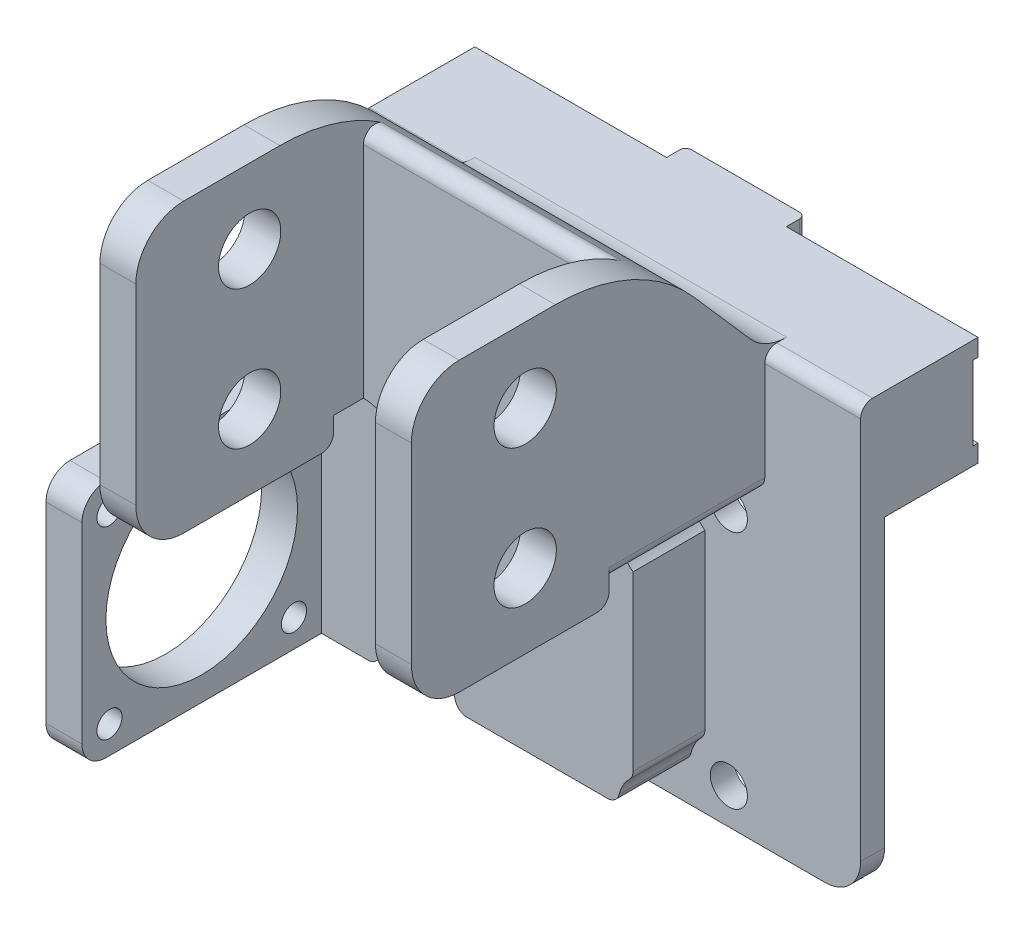
from build123d import *

# Parameters (mm, degrees)
SKETCH1_W           = 36
SKETCH1_H           = 42
SKETCH1_R           = 1.55
BOSS_EXTRUDE1_DEPTH = 2
SKETCH5_W           = 42
SKETCH5_H           = 9.1
BOSS_EXTRUDE2_DEPTH = 7.4
SKETCH6_W           = 10
SKETCH6_H           = 9.1
BOSS_EXTRUDE3_DEPTH = 2
SKETCH2_R           = 3
CUT_EXTRUDE1_DEPTH  = 6
SKETCH4_W           = 16
SKETCH4_H           = 1.45
BOSS_EXTRUDE4_DEPTH = 0.4
FILLET2_R           = 3
FILLET3_R           = 0.5
SKETCH7_W           = 29
SKETCH7_H           = 20
BOSS_EXTRUDE5_DEPTH = 6
SKETCH8_W           = 20
SKETCH8_H           = 20
SKETCH8_R           = 8
SKETCH8_R_2         = 1.05
BOSS_EXTRUDE6_DEPTH = 3
FILLET4_R           = 2
SKETCH10_W          = 24
SKETCH10_H          = 19
SKETCH10_R          = 2.6
BOSS_EXTRUDE7_DEPTH = 3
SKETCH14_W          = 26
SKETCH14_H          = 25
BOSS_EXTRUDE8_DEPTH = 10.5
CUT_EXTRUDE3_REACH  = 60.08
SKETCH9_R           = 3.25
CUT_EXTRUDE2_DEPTH  = 13
FILLET6_R           = 1
FILLET7_R           = 1
FILLET8_R           = 4
FILLET9_R           = 1
FILLET10_R          = 1


with BuildPart() as part:
    # Sketch1 → Boss-Extrude1 (new body)
    with BuildSketch(Plane(origin=(0, 0, 0), x_dir=(0, 1, 0), z_dir=(0, 0, 1))):
        with Locations((5, 0)):
            Rectangle(SKETCH1_W, SKETCH1_H)
        with Locations(Location((-10, -10, 0), (0, 0, 270))):
            Circle(SKETCH1_R, mode=Mode.SUBTRACT)
        with Locations(Location((10, -10, 0), (0, 0, 270))):
            Circle(SKETCH1_R, mode=Mode.SUBTRACT)
        with Locations(Location((10, 10, 0), (0, 0, 270))):
            Circle(SKETCH1_R, mode=Mode.SUBTRACT)
        with Locations(Location((-10, 10, 0), (0, 0, 270))):
            Circle(SKETCH1_R, mode=Mode.SUBTRACT)
    extrude(amount=BOSS_EXTRUDE1_DEPTH)

    # Sketch5 → Boss-Extrude2 (add)
    with BuildSketch(Plane.XY):
        with Locations((0, 18.45)):
            Rectangle(SKETCH5_W, SKETCH5_H)
    extrude(amount=-BOSS_EXTRUDE2_DEPTH)

    # Sketch6 → Boss-Extrude3 (add)
    with BuildSketch(Plane(origin=(0, 0, -7.4), x_dir=(1, 0, 0), z_dir=(0, 0, -1))):
        with Locations((0, -18.45)):
            Rectangle(SKETCH6_W, SKETCH6_H)
    extrude(amount=BOSS_EXTRUDE3_DEPTH)

    # Sketch2 → Cut-Extrude1 (cut)
    with BuildSketch(Plane(origin=(0, 0, -9.4), x_dir=(1, 0, 0), z_dir=(0, 0, -1))):
        with Locations(Location((0, -18.5, 0), (0, 0, 180))):
            Circle(SKETCH2_R)
    extrude(amount=-CUT_EXTRUDE1_DEPTH, mode=Mode.SUBTRACT)

    # Sketch4 → Boss-Extrude4 (add)
    with BuildSketch(Plane(origin=(0, 0, -7.4), x_dir=(1, 0, 0), z_dir=(0, 0, -1))):
        with Locations((-13, -14.625)):
            Rectangle(SKETCH4_W, SKETCH4_H)
        with Locations((-13, -22.275)):
            Rectangle(SKETCH4_W, SKETCH4_H)
        with Locations((13, -14.625)):
            Rectangle(SKETCH4_W, SKETCH4_H)
        with Locations((13, -22.275)):
            Rectangle(SKETCH4_W, SKETCH4_H)
    extrude(amount=BOSS_EXTRUDE4_DEPTH)

    # Fillet2
    fillet2_edges = [part.edges().sort_by_distance(p)[0] for p in [
        (-21, -13, 1),
        (21, -13, 1),
    ]]
    fillet(fillet2_edges, radius=FILLET2_R)

    # Fillet3
    fillet3_edges = [part.edges().sort_by_distance(p)[0] for p in [
        (-5, 18.45, -9.4),
        (5, 18.45, -9.4),
    ]]
    fillet(fillet3_edges, radius=FILLET3_R)

    # Sketch7 → Boss-Extrude5 (add)
    with BuildSketch(Plane.XY.offset(2)):
        with Locations((-6.5, 0)):
            Rectangle(SKETCH7_W, SKETCH7_H)
    extrude(amount=BOSS_EXTRUDE5_DEPTH)

    # Sketch8 → Boss-Extrude6 (add)
    with BuildSketch(Plane(origin=(-21, 0, 0), x_dir=(0, -1, 0), z_dir=(-1, 0, 0))):
        with Locations((0, 18)):
            Rectangle(SKETCH8_W, SKETCH8_H)
        with Locations(Location((0, 18, 0), (0, 0, 90))):
            Circle(SKETCH8_R, mode=Mode.SUBTRACT)
        with Locations(Location((7.7, 25.7, 0), (0, 0, 90))):
            Circle(SKETCH8_R_2, mode=Mode.SUBTRACT)
        with Locations(Location((7.7, 10.3, 0), (0, 0, 90))):
            Circle(SKETCH8_R_2, mode=Mode.SUBTRACT)
        with Locations(Location((-7.7, 25.7, 0), (0, 0, 90))):
            Circle(SKETCH8_R_2, mode=Mode.SUBTRACT)
        with Locations(Location((-7.7, 10.3, 0), (0, 0, 90))):
            Circle(SKETCH8_R_2, mode=Mode.SUBTRACT)
    extrude(amount=-BOSS_EXTRUDE6_DEPTH)

    # Fillet4
    fillet4_edges = [part.edges().sort_by_distance(p)[0] for p in [
        (-19.5, 10, 28),
        (-19.5, -10, 28),
    ]]
    fillet(fillet4_edges, radius=FILLET4_R)



with BuildPart() as body_2:
    # Sketch10 → Boss-Extrude7 (new body)
    with BuildSketch(Plane(origin=(-10, 0, 0), x_dir=(0, 1, 0), z_dir=(-1, 0, 0))):
        with Locations((23, -22)):
            Rectangle(SKETCH10_W, SKETCH10_H)
        with Locations(Location((28.777800617, -22, 0), (0, 0, 270))):
            Circle(SKETCH10_R, mode=Mode.SUBTRACT)
        with Locations(Location((17.222199383, -22, 0), (0, 0, 270))):
            Circle(SKETCH10_R, mode=Mode.SUBTRACT)
    extrude(amount=BOSS_EXTRUDE7_DEPTH)


with BuildPart() as body_3:
    # Mirror1: mirrored copy
    add(body_2.part.mirror(Plane(origin=(0, 0, 0), x_dir=(0, 0, 1), z_dir=(1, 0, 0))))


with BuildPart() as part_1:
    add(part.part)

    add(body_2.part)  # Boss-Extrude8 merges body 2

    add(body_3.part)  # Boss-Extrude8 merges body 3
    # Sketch14 → Boss-Extrude8 (add)
    with BuildSketch(Plane(origin=(0, 0, 12.5), x_dir=(1, 0, 0), z_dir=(0, 0, -1))):
        with Locations((0, -22.5)):
            Rectangle(SKETCH14_W, SKETCH14_H)
    extrude(amount=BOSS_EXTRUDE8_DEPTH)

    # Cut-Extrude3: up to this face of the body (flat: up to its plane)
    cut_extrude3_end = Plane(part_1.part.faces().sort_by_distance((-13, 22.805850567, 16.272591727))[0])
    # Sketch15 → Cut-Extrude3 (cut, up to the picked face)
    with BuildSketch(Plane.YZ.offset(13), mode=Mode.PRIVATE) as cut_extrude3_sk1:
        with BuildLine():
            Line((23, 2), (29.749203665, 7.905553207))
            ThreePointArc((29.749203665, 7.905553207), (33.625901319, 13.123522322), (35, 19.477091335))
            Line((35, 19.477091335), (35, 12.5))
            Line((35, 12.5), (35, 2))
            Line((35, 2), (23, 2))
        make_face()
    cut_extrude3_tool1 = split(extrude(cut_extrude3_sk1.sketch, amount=-CUT_EXTRUDE3_REACH, mode=Mode.PRIVATE), bisect_by=cut_extrude3_end, keep=Keep.BOTH, mode=Mode.PRIVATE)
    # Sketch15 → Cut-Extrude3 (cut, up to the picked face)
    with BuildSketch(Plane.YZ.offset(13), mode=Mode.PRIVATE) as cut_extrude3_sk2:
        Polygon((12.370074724, 12.5), (10, 8), (10, 12.5), align=None)
    cut_extrude3_tool2 = split(extrude(cut_extrude3_sk2.sketch, amount=-CUT_EXTRUDE3_REACH, mode=Mode.PRIVATE), bisect_by=cut_extrude3_end, keep=Keep.BOTH, mode=Mode.PRIVATE)
    add(cut_extrude3_tool1.solids().sort_by(Axis((13, 31.275358, 6.207395), (-1, 0, 0)))[0], mode=Mode.SUBTRACT)
    add(cut_extrude3_tool2.solids().sort_by(Axis((13, 10.790025, 11), (-1, 0, 0)))[0], mode=Mode.SUBTRACT)

    # Sketch9 → Cut-Extrude2 (cut)
    with BuildSketch(Plane.XY.offset(2)):
        with Locations((-10, 10)):
            Circle(SKETCH9_R)
        with Locations((10, 10)):
            Circle(SKETCH9_R)
        with Locations((10, -10)):
            Circle(SKETCH9_R)
        with Locations((-10, -10)):
            Circle(SKETCH9_R)
    extrude(amount=CUT_EXTRUDE2_DEPTH, mode=Mode.SUBTRACT)

    # Fillet6
    # the kernel refuses this fillet: 1 mm, written as the material it takes off along each edge
    with BuildSketch(Plane(origin=(-13, 11.25, 15), x_dir=(0, 1, 0), z_dir=(0, 0, -1))) as fillet6_piece_1:
        with BuildLine():
            CenterArc((2.5, 1), FILLET6_R, 151.927513064, 118.072486936)
            ThreePointArc((1.617647059, 1.470588235), (0.93618658, 0.595194761), (0, 0))
            Line((0, 0), (2.5, 0))
        make_face()
    extrude(amount=8.75, mode=Mode.SUBTRACT)
    with BuildSketch(Plane(origin=(-13, 11.25, 16.623342892), x_dir=(0, 1, 0), z_dir=(0, 0, -1))) as fillet6_piece_2_section:
        with BuildLine():
            CenterArc((2.5, 1), FILLET6_R, 151.927513064, 118.072486936)
            ThreePointArc((1.617647059, 1.470588235), (0.93618658, 0.595194761), (0, 0))
            Line((0, 0), (2.5, 0))
        make_face()
    fillet6_piece_2 = extrude(amount=14.623342892, mode=Mode.PRIVATE)
    fillet6_piece_2 = split(fillet6_piece_2, bisect_by=Plane(origin=(-12.647638468, 12.372868888, 15), z_dir=(0, 0, -1)), keep=Keep.TOP, mode=Mode.PRIVATE)
    add(fillet6_piece_2, mode=Mode.SUBTRACT)
    with BuildSketch(Plane(origin=(-13.25, 10, 10.201694776), x_dir=(-1, 0, 0), z_dir=(0, 0, -1))) as fillet6_piece_3:
        with BuildLine():
            CenterArc((0.88067791, -1), FILLET6_R, 90, 76.391039369)
            ThreePointArc((-0.091246304, -0.764705882), (-0.022892199, -0.385065246), (0, 0))
            Line((0, 0), (0.88067791, 0))
        make_face()
    extrude(amount=8.201694776, mode=Mode.SUBTRACT)
    with BuildSketch(Plane(origin=(-6.75, -10, 2), x_dir=(1, 0, 0), z_dir=(0, 0, 1)), Plane(origin=(-13.25, -10, 10.201694776), x_dir=(-1, 0, 0), z_dir=(0, 0, -1))) as fillet6_piece_4:
        with BuildLine():
            CenterArc((0.88067791, 1), FILLET6_R, 193.608960631, 76.391039369)
            ThreePointArc((-0.091246304, 0.764705882), (-0.022892199, 0.385065246), (0, 0))
            Line((0, 0), (0.88067791, 0))
        make_face()
    extrude(amount=8.201694776, mode=Mode.SUBTRACT)
    with BuildSketch(Plane(origin=(8, -7.438262309, 9.121652383), x_dir=(0, 1, 0), z_dir=(0, 0, -1))) as fillet6_piece_5:
        with BuildLine():
            CenterArc((0.448660953, -1), FILLET6_R, 90, 45.099127844)
            ThreePointArc((-0.25966814, -0.294117647), (-0.125391755, -0.150980818), (0, 0))
            Line((0, 0), (0.448660953, 0))
        make_face()
    extrude(amount=7.121652383, mode=Mode.SUBTRACT)
    with BuildSketch(Plane(origin=(6.75, -10, 10.201694776), x_dir=(0.11848161412860787, 0.9929562463238145, 0), z_dir=(0, 0, -1))) as fillet6_piece_6:
        with BuildLine():
            CenterArc((0.888612106, -0.992956246), FILLET6_R, 96.804480315, 76.391039369)
            Line((-0.10434414, -0.874474632), (0, 0))
            ThreePointArc((0, 0), (0.385065246, -0.022892199), (0.770130492, 0))
        make_face()
    extrude(amount=8.201694776, mode=Mode.SUBTRACT)
    with BuildSketch(Plane(origin=(13, 11.25, 16.623342892), x_dir=(0, 1, 0), z_dir=(0, 0, -1))) as fillet6_piece_7_section:
        with BuildLine():
            CenterArc((2.5, -1), FILLET6_R, 90, 118.072486936)
            ThreePointArc((1.617647059, -1.470588235), (0.93618658, -0.595194761), (0, 0))
            Line((0, 0), (2.5, 0))
        make_face()
    fillet6_piece_7 = extrude(amount=14.623342892, mode=Mode.PRIVATE)
    fillet6_piece_7 = split(fillet6_piece_7, bisect_by=Plane(origin=(12.647638468, 12.372868888, 15), z_dir=(0, 0, -1)), keep=Keep.TOP, mode=Mode.PRIVATE)
    add(fillet6_piece_7, mode=Mode.SUBTRACT)
    with BuildSketch(Plane(origin=(13, 11.25, 15), x_dir=(0, 1, 0), z_dir=(0, 0, -1))) as fillet6_piece_8:
        with BuildLine():
            CenterArc((2.5, -1), FILLET6_R, 90, 118.072486936)
            ThreePointArc((1.617647059, -1.470588235), (0.93618658, -0.595194761), (0, 0))
            Line((0, 0), (2.5, 0))
        make_face()
    extrude(amount=8.75, mode=Mode.SUBTRACT)
    with BuildSketch(Plane(origin=(9.285048768, 12.370074724, 12.5), x_dir=(0, 1, 0), z_dir=(-1, 0, 0))) as fillet6_piece_9:
        with BuildLine():
            CenterArc((FILLET6_R * 0.603535852363, FILLET6_R), FILLET6_R, 207.775026011, 62.224973989)
            Line((-FILLET6_R * 0.281248326648, FILLET6_R * 0.533998973637), (0, 0))
            Line((0, 0), (FILLET6_R * 0.603535852363, 0))
        make_face()
    extrude(amount=18.570097535, mode=Mode.SUBTRACT)

    # Fillet7
    fillet7_edges = [part_1.edges().sort_by_distance(p)[0] for p in [
        (11.5, 11, 15),
        (-11.5, 11, 15),
    ]]
    fillet(fillet7_edges, radius=FILLET7_R)

    # Fillet8
    fillet8_edges = [part_1.edges().sort_by_distance(p)[0] for p in [
        (0, 23, 2),
        (-11.5, 35, 31.5),
        (-11.5, 11, 31.5),
        (11.5, 11, 31.5),
        (11.5, 35, 31.5),
    ]]
    fillet(fillet8_edges, radius=FILLET8_R)

    # Fillet9
    fillet9_edges = [part_1.edges().sort_by_distance(p)[0] for p in [
        (17, 23, 2),
        (-17, 23, 2),
    ]]
    fillet(fillet9_edges, radius=FILLET9_R)

    # Fillet10
    fillet10_edges = [part_1.edges().sort_by_distance(p)[0] for p in [
        (0, 33.325868907, 12.5),
    ]]
    fillet(fillet10_edges, radius=FILLET10_R)


solid = part_1.part
